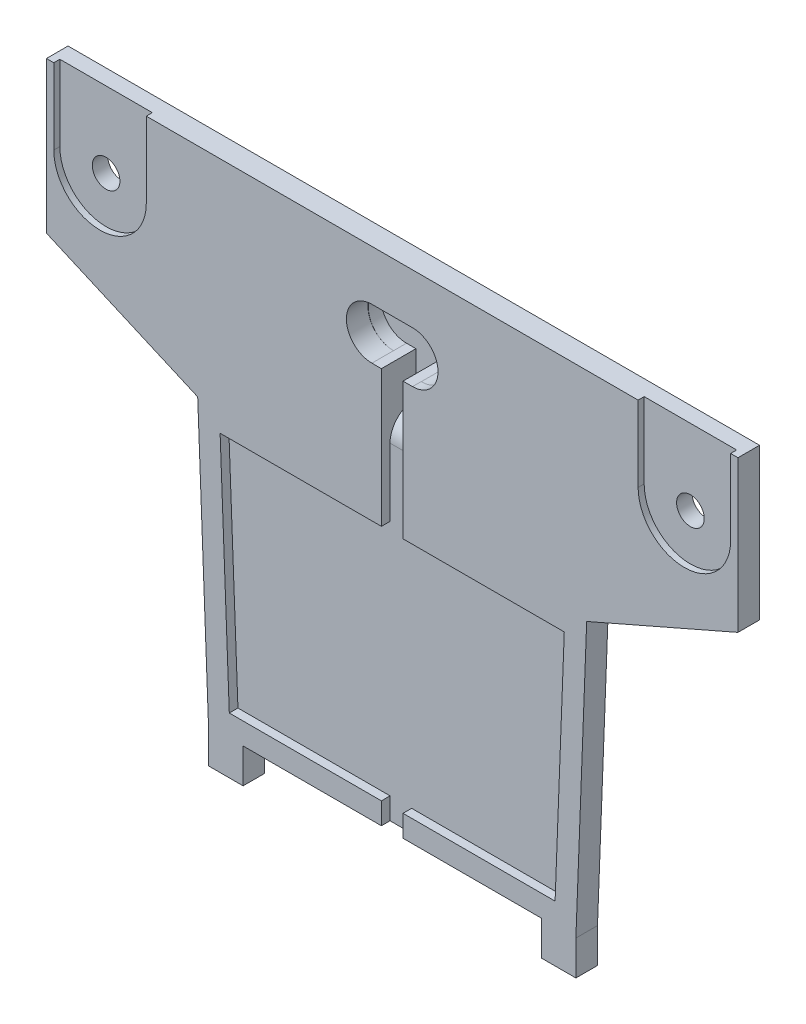
from build123d import *

# Parameters (mm, degrees)
MAIN_BODY_DEPTH          = 6.35
BATTERY_SPACING_DEPTH    = 2.54
SKETCH8_R                = 4.064
LIGHT_SOCKETS_DEPTH      = 12.7
LIGHT_LEADS_POCKET_DEPTH = 6.35
WIRE_TRAIL_DEPTH         = 2.54
LEAD_ROOM_DEPTH          = 7.62
FILLET1_R                = 7.62
TAB_SLOTS_DEPTH          = 1.778
SKETCH14_W               = 10.16
SKETCH14_H               = 6.35
SCREW_MOUNT_DEPTH        = 10.16


# Sheet-metal steps are written as plain solids
with BuildPart() as part:
    # Sketch1 → Main Body (new body)
    with BuildSketch(Plane.XY):
        Polygon((-53.975, 0), (53.975, 0), (57.15, 82.161327118), (101.6, 101.6), (101.6, 146.05), (-101.6, 146.05), (-101.6, 101.6), (-57.15, 82.161327118), align=None)
    extrude(amount=-MAIN_BODY_DEPTH)

    # Sketch7 → Battery Spacing (cut)
    with BuildSketch(Plane.XY):
        Polygon((-50.564894027, 76.2), (-47.86564661, 6.35), (47.86564661, 6.35), (50.564894027, 76.2), align=None)
    extrude(amount=-BATTERY_SPACING_DEPTH, mode=Mode.SUBTRACT)

    # Sketch8 → Light Sockets (cut)
    with BuildSketch(Plane.XY):
        with Locations((85.852, 123.825)):
            Circle(SKETCH8_R)
        with Locations((-85.852, 123.825)):
            Circle(SKETCH8_R)
        with BuildLine():
            Line((-5.969, 131.318), (5.969, 131.318))
            ThreePointArc((5.969, 131.318), (13.462, 123.825), (5.969, 116.332))
            Line((5.969, 116.332), (-5.969, 116.332))
            ThreePointArc((-5.969, 116.332), (-13.462, 123.825), (-5.969, 131.318))
        make_face()
    extrude(amount=-LIGHT_SOCKETS_DEPTH, mode=Mode.SUBTRACT)

    # Sketch9 → Light Leads Pocket (add)
    with BuildSketch(Plane(origin=(0, 0, -6.35), x_dir=(-1, 0, 0), z_dir=(0, 0, -1))):
        with BuildLine():
            Line((-9.525, 111.765348554), (-9.525, 99.065348554))
            Line((-9.525, 99.065348554), (9.525, 99.065348554))
            Line((9.525, 99.065348554), (9.525, 111.765348554))
            ThreePointArc((9.525, 111.765348554), (18.413001098, 125.621431375), (5.969, 136.398))
            Line((5.969, 136.398), (-5.969, 136.398))
            ThreePointArc((-5.969, 136.398), (-18.413001098, 125.621431375), (-9.525, 111.765348554))
        make_face()
    extrude(amount=LIGHT_LEADS_POCKET_DEPTH)

    # Sketch10 → Wire Trail (cut)
    with BuildSketch(Plane.XY):
        Polygon((-3.175, 116.332), (3.175, 116.332), (3.175, 76.2), (3.175, 6.35), (3.175, 0), (-3.175, 0), align=None)
    extrude(amount=-WIRE_TRAIL_DEPTH, mode=Mode.SUBTRACT)

    # Sketch12 → Lead Room (cut)
    with BuildSketch(Plane.XY.offset(-2.54)):
        with BuildLine():
            Line((-3.175, 116.332), (-5.960094489, 116.332))
            ThreePointArc((-5.960094489, 116.332), (-13.36178344, 123.73368895), (-5.960094489, 131.135377901))
            Line((-5.960094489, 131.135377901), (6.000168296, 131.135377901))
            ThreePointArc((6.000168296, 131.135377901), (13.401857247, 123.73368895), (6.000168296, 116.332))
            Line((6.000168296, 116.332), (3.175, 116.332))
            Line((3.175, 116.332), (3.175, 103.730451358))
            Line((3.175, 103.730451358), (-3.175, 103.730451358))
            Line((-3.175, 103.730451358), (-3.175, 116.332))
        make_face()
    extrude(amount=-LEAD_ROOM_DEPTH, mode=Mode.SUBTRACT)

    # Fillet1
    fillet1_edges = [part.edges().sort_by_distance(p)[0] for p in [
        (0, 103.730451358, -2.54),
    ]]
    fillet(fillet1_edges, radius=FILLET1_R - 0.0001)  # a hair under: the kernel refuses the full size

    # Sketch13 → Tab Slots (cut)
    with BuildSketch(Plane.XY):
        with BuildLine():
            Line((72.263, 146.05), (72.263, 123.825))
            ThreePointArc((72.263, 123.825), (85.852, 110.236), (99.441, 123.825))
            Line((99.441, 123.825), (99.441, 146.05))
            Line((99.441, 146.05), (72.263, 146.05))
        make_face()
    tab_slots = extrude(amount=-TAB_SLOTS_DEPTH, mode=Mode.SUBTRACT)

    # Mirror1: Tab Slots across plane
    add(tab_slots.mirror(Plane(origin=(0, 0, 0), x_dir=(0, 0, 1), z_dir=(1, 0, 0))), mode=Mode.SUBTRACT)

    # Sketch14 → Screw Mount (add)
    with BuildSketch(Plane.XZ):
        with Locations((48.895, -3.175)):
            Rectangle(SKETCH14_W, SKETCH14_H)
    screw_mount = extrude(amount=SCREW_MOUNT_DEPTH)

    # Mirror2: Screw Mount across plane
    add(screw_mount.mirror(Plane(origin=(0, 0, 0), x_dir=(0, 0, 1), z_dir=(1, 0, 0))))


solid = part.part
